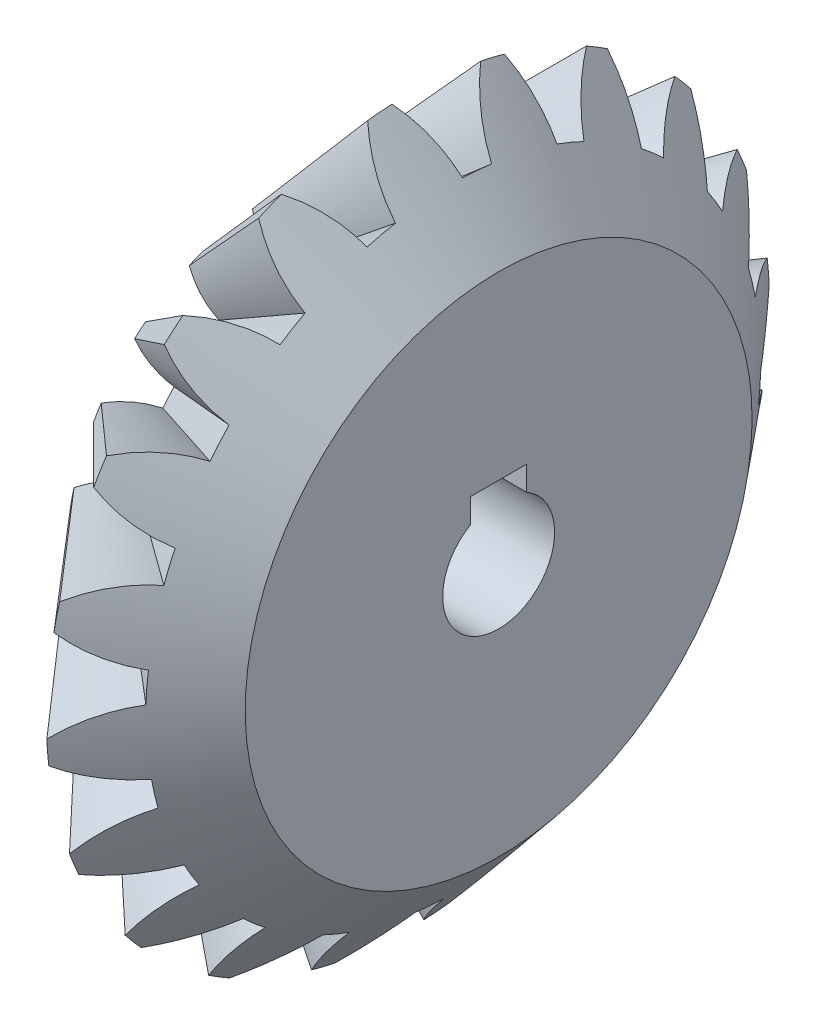
from build123d import *

# Parameters (mm, degrees)
CIRPATTERN1_COUNT  = 20
CUT_EXTRUDE1_DEPTH = 50


with BuildPart() as part:
    # Sketch2 → Revolve1 (revolve)
    with BuildSketch(Plane.XY):
        Polygon((-1.928362829, 32.298133329), (6.170761053, 22.645973346), (6.170761053, 0), (-8.065230058, 0), (-8.065230058, 13.783422389), (-13.736298816, 18.712381685), align=None)
    revolve(axis=Axis((0, 0, 0), (-1, 0, 0)))

    # Sketch3 → Cut-Loft1 section 0
    with BuildSketch(Plane(origin=(14.772116295, 12.395277335, 1.153e-06), x_dir=(4.4132900378951394e-08, 4.04403524198462e-08, -0.9999999999999982), z_dir=(0.7660444431189751, 0.64278760968654, 5.980232056085335e-08)), mode=Mode.PRIVATE) as cut_loft1_s0:
        with BuildLine():
            ThreePointArc((-8.558969188, 31.440904395), (-2.13548183, 26.940413623), (0.826685151, 19.678101747))
            ThreePointArc((0.826685151, 19.678101747), (2.125602913, 19.619032397), (3.421118351, 19.508053611))
            ThreePointArc((3.421118351, 19.508053611), (7.305865499, 26.321595026), (14.261830955, 29.945150129))
            ThreePointArc((14.261830955, 29.945150129), (2.947876952, 32.164509911), (-8.558969188, 31.440904395))
        make_face()
    cut_loft1 = loft([Vertex(-30, 0, 0), cut_loft1_s0.sketch], mode=Mode.SUBTRACT)

    # CirPattern1: Cut-Loft1 ×20 about axis
    cirpattern1_axis = Axis((-8.065230058, 0, 0), (1, 0, 0))
    for i in range(1, CIRPATTERN1_COUNT):
        add(cut_loft1.rotate(cirpattern1_axis, i * 360 / CIRPATTERN1_COUNT), mode=Mode.SUBTRACT)

    # Sketch6 → Cut-Extrude1 (cut)
    with BuildSketch(Plane.ZY.offset(8.065230058)):
        with BuildLine():
            Line((-2.5, 4.330127019), (-2.5, 6.5))
            Line((-2.5, 6.5), (2.5, 6.5))
            Line((2.5, 6.5), (2.5, 4.330127019))
            ThreePointArc((2.5, 4.330127019), (0, -5), (-2.5, 4.330127019))
        make_face()
    extrude(amount=-CUT_EXTRUDE1_DEPTH, mode=Mode.SUBTRACT)


solid = part.part
